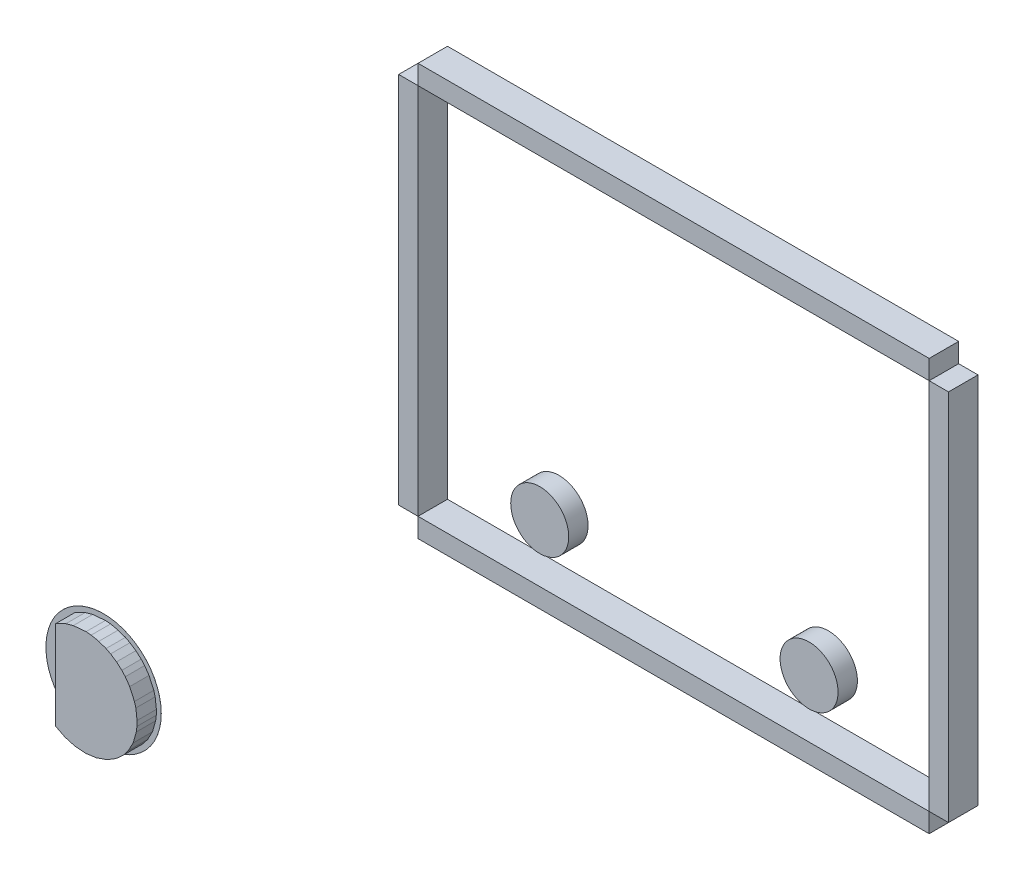
from build123d import *

# Parameters (mm, degrees)
SKETCH2_R               = 2.981293854
ENCODERAXISATTACH_DEPTH = 0.001
SKETCH3_W               = 1.524000079
SKETCH3_H               = 19.278004866
BOSS_EXTRUDE3_DEPTH     = 1
SKETCH4_W               = 26.419990765
SKETCH4_H               = 1.524000079
BOSS_EXTRUDE4_DEPTH     = 1
SKETCH6_W               = 1.524000079
SKETCH6_H               = 19.278005766
BOSS_EXTRUDE5_DEPTH     = 1
SKETCH7_W               = 26.419990765
SKETCH7_H               = 1.524000079
BOSS_EXTRUDE6_DEPTH     = 1
BOSS_EXTRUDE1_DEPTH     = 1
SKETCH8_R               = 1.499263455
BOSS_EXTRUDE7_DEPTH     = 1
SKETCH8_R_2             = 1.500016471
BOSS_EXTRUDE7_2_DEPTH   = 1


# Read off the part's stored shape, not the designer's step: Surface-Imported1
with BuildPart() as part:
    # Sketch2 → encoderaxisattach (new body)
    with BuildSketch(Plane.XY.offset(28.477000073)):
        with Locations((135.281426774, -151.791471956)):
            Circle(SKETCH2_R)
    extrude(amount=ENCODERAXISATTACH_DEPTH)


with BuildPart() as body_2:
    # Sketch3 → Boss-Extrude3 (new body)
    with BuildSketch(Plane.ZY.offset(-124.580003321)):
        with Locations((0.76200004, -153.638996134)):
            Rectangle(SKETCH3_W, SKETCH3_H)
    extrude(amount=BOSS_EXTRUDE3_DEPTH)


with BuildPart() as body_3:
    # Sketch4 → Boss-Extrude4 (new body)
    with BuildSketch(Plane(origin=(0, -143.999993801, 0), x_dir=(1, 0, 0), z_dir=(0, 1, 0))):
        with Locations((137.789998704, -0.76200004)):
            Rectangle(SKETCH4_W, SKETCH4_H)
    extrude(amount=BOSS_EXTRUDE4_DEPTH)


with BuildPart() as body_4:
    # Sketch6 → Boss-Extrude5 (new body)
    with BuildSketch(Plane(origin=(150.999993086, 0, 0), x_dir=(0, 0, -1), z_dir=(1, 0, 0))):
        with Locations((-0.76200004, -153.638996684)):
            Rectangle(SKETCH6_W, SKETCH6_H)
    extrude(amount=BOSS_EXTRUDE5_DEPTH)


with BuildPart() as body_5:
    # Sketch7 → Boss-Extrude6 (new body)
    with BuildSketch(Plane.XZ.offset(163.277998567)):
        with Locations((137.789997704, 0.76200004)):
            Rectangle(SKETCH7_W, SKETCH7_H)
    extrude(amount=BOSS_EXTRUDE6_DEPTH)


with BuildPart() as body_6:
    # Sketch1 → Boss-Extrude1 (new body)
    with BuildSketch(Plane.XY.offset(28.477000073)):
        Polygon((133.796989918, -154.082998633), (134.2689991, -154.328003526), (134.780004621, -154.476001859), (135.377004743, -154.520004988), (135.904014111, -154.449999332), (136.468008161, -154.251992702), (136.923000216, -153.975993395), (137.315005064, -153.617009521), (137.559011579, -153.301000595), (137.80900836, -152.830988169), (137.97301054, -152.257010341), (138.006001711, -151.99200809), (138.011991978, -151.72599256), (137.94799149, -151.198998094), (137.877002358, -150.941997766), (137.63000071, -150.398001075), (137.401998043, -150.070011616), (137.224003673, -149.871990085), (136.948004365, -149.632006884), (136.643990874, -149.427995086), (136.408001184, -149.305999279), (136.032000184, -149.171993136), (135.641992092, -149.087995291), (135.377004743, -149.066001177), (134.716004133, -149.12699163), (134.332001209, -149.234995246), (133.796989918, -149.503007531), align=None)
    extrude(amount=BOSS_EXTRUDE1_DEPTH)


with BuildPart() as body_7:
    # Sketch8 → Boss-Extrude7 (new body)
    with BuildSketch(Plane(origin=(0, 0, 0), x_dir=(-1, 0, 0), z_dir=(0, 0, -1))):
        with Locations((-144.26888852, -160.818724299)):
            Circle(SKETCH8_R)
    extrude(amount=-BOSS_EXTRUDE7_DEPTH)


with BuildPart() as body_8:
    # Sketch8 → Boss-Extrude7 2 (new body)
    with BuildSketch(Plane(origin=(0, 0, 0), x_dir=(-1, 0, 0), z_dir=(0, 0, -1))):
        with Locations((-130.346982161, -160.824667911)):
            Circle(SKETCH8_R_2)
    extrude(amount=-BOSS_EXTRUDE7_2_DEPTH)


solid = Compound([part.part, body_2.part, body_3.part, body_4.part, body_5.part, body_6.part, body_7.part, body_8.part])
